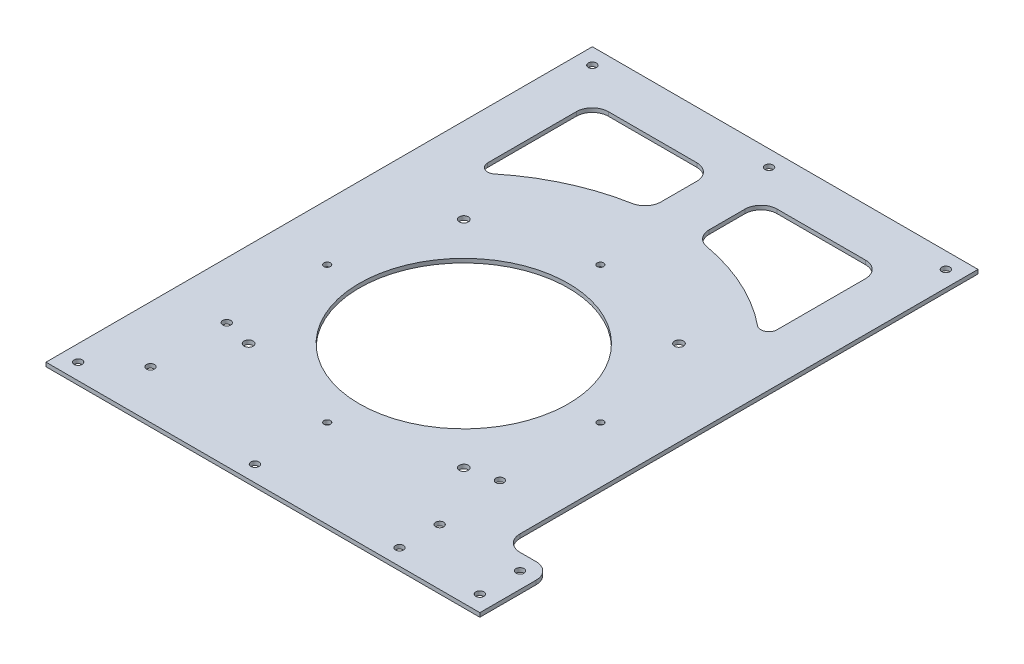
from build123d import *

# Parameters (mm, degrees)
BASE_FLANGE1_DEPTH = 3.175
SKETCH2_R          = 2.5781
SKETCH2_R_2        = 3.5687
SKETCH2_R_3        = 3.175
CUT_EXTRUDE1_DEPTH = 318.515874603
FILLET1_R          = 12.7
SKETCH3_R          = 82.55
CUT_EXTRUDE2_DEPTH = 318.515874603


# Sheet-metal steps are written as plain solids
with BuildPart() as part:
    # Sketch1 → Base-Flange1 (new body)
    with BuildSketch(Plane(origin=(0, 0, 0), x_dir=(1, 0, 0), z_dir=(0, 1, 0))):
        Polygon((152.4, -177.8), (-152.4, -177.8), (-152.4, 254), (152.4, 254), (152.4, -120.65), (190.5, -120.65), (190.5, -177.8), align=None)
    extrude(amount=-BASE_FLANGE1_DEPTH)

    # Sketch2 → Cut-Extrude1 (cut, through all)
    with BuildSketch(Plane(origin=(0, 0, 0), x_dir=(1, 0, 0), z_dir=(0, 1, 0))):
        with Locations(Location((-107.95, 0, 0), (0, 0, 270))):
            Circle(SKETCH2_R)
        with Locations(Location((0, 107.95, 0), (0, 0, 270))):
            Circle(SKETCH2_R)
        with Locations(Location((107.95, 0, 0), (0, 0, 270))):
            Circle(SKETCH2_R)
        with Locations(Location((85.03404521, 85.03404521, 0), (0, 0, 270))):
            Circle(SKETCH2_R_2)
        with Locations(Location((85.03404521, -85.03404521, 0), (0, 0, 270))):
            Circle(SKETCH2_R_2)
        with Locations(Location((0, -107.95, 0), (0, 0, 270))):
            Circle(SKETCH2_R)
        with Locations(Location((-85.03404521, -85.03404521, 0), (0, 0, 270))):
            Circle(SKETCH2_R_2)
        with Locations(Location((-85.03404521, 85.03404521, 0), (0, 0, 270))):
            Circle(SKETCH2_R_2)
        with Locations(Location((0, 241.3, 0), (0, 0, 270))):
            Circle(SKETCH2_R_3)
        with Locations(Location((-139.7, 241.3, 0), (0, 0, 270))):
            Circle(SKETCH2_R_3)
        with Locations(Location((0, -165.1, 0), (0, 0, 270))):
            Circle(SKETCH2_R_3)
        with Locations(Location((-139.7, -165.1, 0), (0, 0, 90))):
            Circle(SKETCH2_R_3)
        with Locations(Location((139.7, 241.3, 0), (0, 0, 90))):
            Circle(SKETCH2_R_3)
        with Locations(Location((177.8, -165.1, 0), (0, 0, 270))):
            Circle(SKETCH2_R_3)
        with Locations(Location((177.8, -133.35, 0), (0, 0, 270))):
            Circle(SKETCH2_R_3)
        with Locations(Location((114.3, -165.1, 0), (0, 0, 270))):
            Circle(SKETCH2_R_3)
        with Locations(Location((107.95, -79.375, 0), (0, 0, 270))):
            Circle(SKETCH2_R_3)
        with Locations(Location((114.3, -133.35, 0), (0, 0, 270))):
            Circle(SKETCH2_R_3)
        with Locations(Location((-107.95, -79.375, 0), (0, 0, 270))):
            Circle(SKETCH2_R_3)
        with Locations(Location((-107.95, -139.7, 0), (0, 0, 270))):
            Circle(SKETCH2_R_3)
    extrude(amount=-CUT_EXTRUDE1_DEPTH, mode=Mode.SUBTRACT)

    # Fillet1
    fillet1_edges = [part.edges().sort_by_distance(p)[0] for p in [
        (152.4, -1.5875, 120.65),
        (190.5, -1.5875, 120.65),
    ]]
    fillet(fillet1_edges, radius=FILLET1_R)

    # Sketch3 → Cut-Extrude2 (cut, through all)
    with BuildSketch(Plane(origin=(0, 0, 0), x_dir=(1, 0, 0), z_dir=(0, 1, 0))):
        with Locations(Location((0, 0, 0), (0, 0, 270))):
            Circle(SKETCH3_R)
        with BuildLine():
            Line((114.3, 203.2), (114.3, 133.198723718))
            ThreePointArc((114.3, 133.198723718), (110.682604916, 127.466763288), (103.951851852, 128.265437654))
            ThreePointArc((103.951851852, 128.265437654), (68.871193184, 150.049221089), (29.482142857, 162.44633961))
            ThreePointArc((29.482142857, 162.44633961), (22.000851686, 166.803163593), (19.05, 174.942211887))
            Line((19.05, 174.942211887), (19.05, 203.2))
            ThreePointArc((19.05, 203.2), (22.769743879, 212.180256121), (31.75, 215.9))
            Line((31.75, 215.9), (101.6, 215.9))
            ThreePointArc((101.6, 215.9), (110.580256121, 212.180256121), (114.3, 203.2))
        make_face()
        with BuildLine():
            Line((-101.6, 215.9), (-31.75, 215.9))
            ThreePointArc((-31.75, 215.9), (-22.769743879, 212.180256121), (-19.05, 203.2))
            Line((-19.05, 203.2), (-19.05, 174.942211887))
            ThreePointArc((-19.05, 174.942211887), (-22.000851686, 166.803163593), (-29.482142857, 162.44633961))
            ThreePointArc((-29.482142857, 162.44633961), (-68.871193184, 150.049221089), (-103.951851852, 128.265437654))
            ThreePointArc((-103.951851852, 128.265437654), (-110.682604916, 127.466763288), (-114.3, 133.198723718))
            Line((-114.3, 133.198723718), (-114.3, 203.2))
            ThreePointArc((-114.3, 203.2), (-110.580256121, 212.180256121), (-101.6, 215.9))
        make_face()
    extrude(amount=-CUT_EXTRUDE2_DEPTH, mode=Mode.SUBTRACT)


solid = part.part
